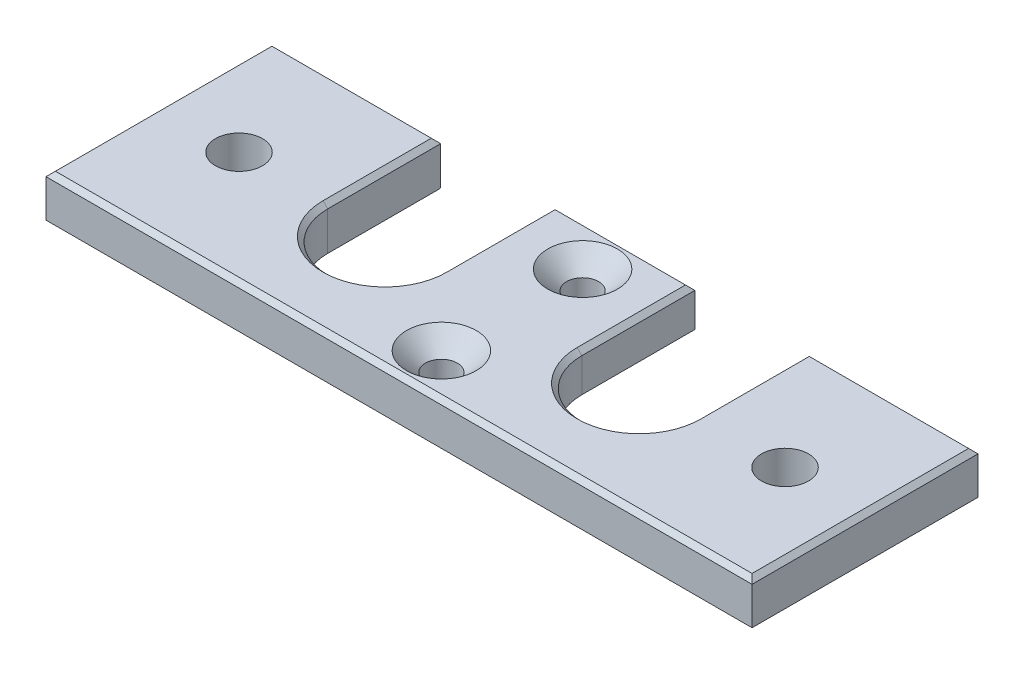
from build123d import *

# Parameters (mm, degrees)
SKETCH1_R           = 1.7
SKETCH1_R_2         = 2.5
BOSS_EXTRUDE1_DEPTH = 5
CHAMFER2_SIZE       = 2
CUT_EXTRUDE1_DEPTH  = 0.4
CHAMFER1_SIZE       = 0.5


with BuildPart() as part:
    # Sketch1 → Boss-Extrude1 (new body)
    with BuildSketch(Plane(origin=(0, 0, 0), x_dir=(1, 0, 0), z_dir=(0, 1, 0))):
        with BuildLine():
            Line((-37.5, -12), (37.5, -12))
            Line((37.5, -12), (37.5, 12))
            Line((37.5, 12), (19.575, 12))
            Line((19.575, 12), (19.575, 0))
            ThreePointArc((19.575, 0), (13.5, -6.075), (7.425, 0))
            Line((7.425, 0), (7.425, 12))
            Line((7.425, 12), (-7.425, 12))
            Line((-7.425, 12), (-7.425, 0))
            ThreePointArc((-7.425, 0), (-13.5, -6.075), (-19.575, 0))
            Line((-19.575, 0), (-19.575, 12))
            Line((-19.575, 12), (-37.5, 12))
            Line((-37.5, 12), (-37.5, -12))
        make_face()
        with Locations((0, -7.5)):
            Circle(SKETCH1_R, mode=Mode.SUBTRACT)
        with Locations((-29, 0)):
            Circle(SKETCH1_R_2, mode=Mode.SUBTRACT)
        with Locations((29, 0)):
            Circle(SKETCH1_R_2, mode=Mode.SUBTRACT)
        with Locations((0, 7.5)):
            Circle(SKETCH1_R, mode=Mode.SUBTRACT)
    extrude(amount=BOSS_EXTRUDE1_DEPTH)

    # Chamfer2
    chamfer2_edges = [part.edges().sort_by_distance(p)[0] for p in [
        (-1.7, 5, -7.5),
        (-1.7, 5, 7.5),
    ]]
    chamfer(chamfer2_edges, length=CHAMFER2_SIZE)

    # Sketch2 → Cut-Extrude1 (cut)
    with BuildSketch(Plane.XZ):
        with BuildLine():
            Line((-5.025, 0), (-5.025, -12))
            Line((-5.025, -12), (-21.975, -12))
            Line((-21.975, -12), (-21.975, 0))
            ThreePointArc((-21.975, 0), (-13.5, 8.475), (-5.025, 0))
        make_face()
        with BuildLine():
            Line((21.975, -12), (5.025, -12))
            Line((5.025, -12), (5.025, 0))
            ThreePointArc((5.025, 0), (13.5, 8.475), (21.975, 0))
            Line((21.975, 0), (21.975, -12))
        make_face()
    extrude(amount=-CUT_EXTRUDE1_DEPTH, mode=Mode.SUBTRACT)

    # Chamfer1
    chamfer1_edges = [part.edges().sort_by_distance(p)[0] for p in [
        (0, 0, -12),
    ]]
    chamfer(chamfer1_edges, length=CHAMFER1_SIZE)
    chamfer1_2_edges = [part.edges().sort_by_distance(p)[0] for p in [
        (29.7375, 0, -12),
    ]]
    chamfer(chamfer1_2_edges, length=CHAMFER1_SIZE)
    chamfer1_3_edges = [part.edges().sort_by_distance(p)[0] for p in [
        (37.5, 0, 0.25),
    ]]
    chamfer(chamfer1_3_edges, length=CHAMFER1_SIZE)
    chamfer1_4_edges = [part.edges().sort_by_distance(p)[0] for p in [
        (-0.25, 0, 12),
    ]]
    chamfer(chamfer1_4_edges, length=CHAMFER1_SIZE)
    chamfer1_5_edges = [part.edges().sort_by_distance(p)[0] for p in [
        (-37.5, 0, -0.25),
    ]]
    chamfer(chamfer1_5_edges, length=CHAMFER1_SIZE)
    chamfer1_6_edges = [part.edges().sort_by_distance(p)[0] for p in [
        (-29.4875, 0, -12),
    ]]
    chamfer(chamfer1_6_edges, length=CHAMFER1_SIZE)
    chamfer1_7_edges = [part.edges().sort_by_distance(p)[0] for p in [
        (-28.5375, 5, -12),
    ]]
    chamfer(chamfer1_7_edges, length=CHAMFER1_SIZE)
    chamfer1_8_edges = [part.edges().sort_by_distance(p)[0] for p in [
        (-37.5, 5, 0.25),
    ]]
    chamfer(chamfer1_8_edges, length=CHAMFER1_SIZE)
    chamfer1_9_edges = [part.edges().sort_by_distance(p)[0] for p in [
        (0.25, 5, 12),
    ]]
    chamfer(chamfer1_9_edges, length=CHAMFER1_SIZE)
    chamfer1_10_edges = [part.edges().sort_by_distance(p)[0] for p in [
        (37.5, 5, -0.25),
    ]]
    chamfer(chamfer1_10_edges, length=CHAMFER1_SIZE)
    chamfer1_11_edges = [part.edges().sort_by_distance(p)[0] for p in [
        (28.2875, 5, -12),
    ]]
    chamfer(chamfer1_11_edges, length=CHAMFER1_SIZE)
    chamfer1_12_edges = [part.edges().sort_by_distance(p)[0] for p in [
        (19.575, 5, -5.75),
        (13.5, 5, 6.075),
        (7.425, 5, -6),
    ]]
    chamfer(chamfer1_12_edges, length=CHAMFER1_SIZE)
    chamfer1_13_edges = [part.edges().sort_by_distance(p)[0] for p in [
        (-0.25, 5, -12),
    ]]
    chamfer(chamfer1_13_edges, length=CHAMFER1_SIZE)
    chamfer1_14_edges = [part.edges().sort_by_distance(p)[0] for p in [
        (-7.425, 5, -5.75),
        (-13.5, 5, 6.075),
        (-19.575, 5, -5.75),
    ]]
    chamfer(chamfer1_14_edges, length=CHAMFER1_SIZE)
    chamfer1_15_edges = [part.edges().sort_by_distance(p)[0] for p in [
        (19.575, 0.4, -5.95),
        (13.5, 0.4, 6.075),
        (7.425, 0.4, -5.95),
    ]]
    chamfer(chamfer1_15_edges, length=CHAMFER1_SIZE)


solid = part.part
